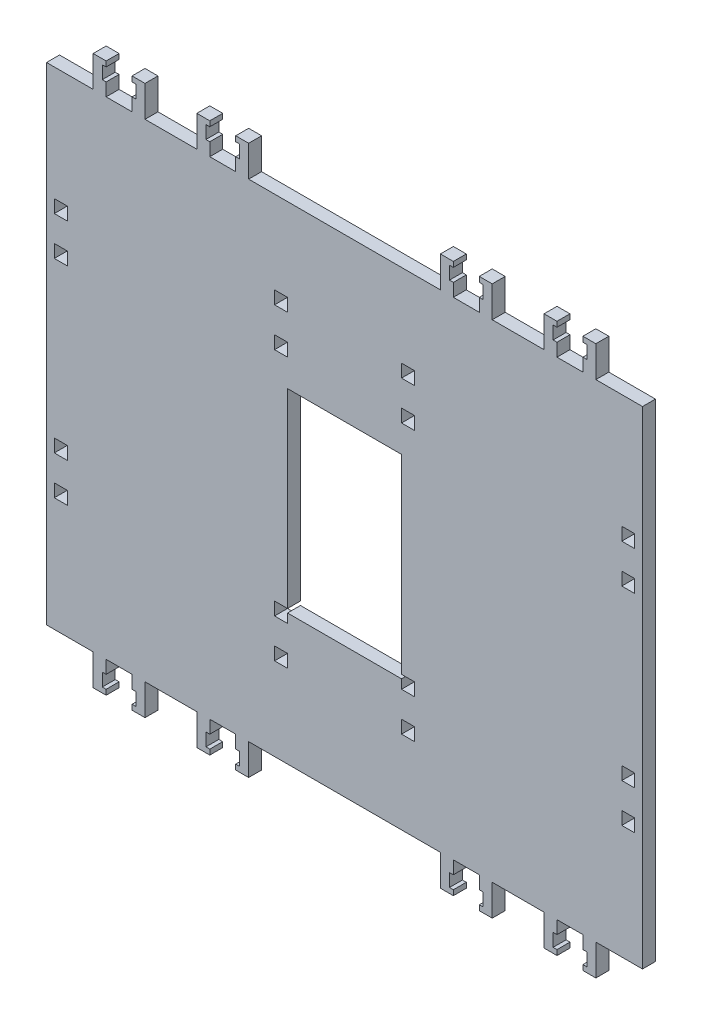
from build123d import *

# Parameters (mm, degrees)
ESQUISSE1_W        = 5
ESQUISSE1_H        = 5
BOSS_EXTRU_1_DEPTH = 5


with BuildPart() as part:
    # Esquisse1 → Boss.-Extru.1 (new body)
    with BuildSketch(Plane.XY):
        Polygon((-30, 193), (-30, 188), (-45, 188), (-89, 188), (-104, 188), (-104, 193), (-104, 200), (-109, 200), (-109, 198), (-107.5, 198), (-107.5, 193), (-109, 193), (-109, 188), (-114, 188), (-119, 188), (-119, 193), (-120.5, 193), (-120.5, 198), (-119, 198), (-119, 200), (-124, 200), (-124, 193), (-124, 188), (-144, 188), (-144, 193), (-144, 200), (-149, 200), (-149, 198), (-147.5, 198), (-147.5, 193), (-149, 193), (-149, 188), (-154, 188), (-159, 188), (-159, 193), (-160.5, 193), (-160.5, 198), (-159, 198), (-159, 200), (-164, 200), (-164, 193), (-164, 188), (-179, 188), (-182, 188), (-182, 0), (-179, 0), (-164, 0), (-164, -5), (-164, -12), (-159, -12), (-159, -10), (-160.5, -10), (-160.5, -5), (-159, -5), (-159, 0), (-154, 0), (-149, 0), (-149, -5), (-147.5, -5), (-147.5, -10), (-149, -10), (-149, -12), (-144, -12), (-144, -5), (-144, 0), (-124, 0), (-124, -5), (-124, -12), (-119, -12), (-119, -10), (-120.5, -10), (-120.5, -5), (-119, -5), (-119, 0), (-114, 0), (-109, 0), (-109, -5), (-107.5, -5), (-107.5, -10), (-109, -10), (-109, -12), (-104, -12), (-104, -5), (-104, 0), (-89, 0), (-45, 0), (-30, 0), (-30, -5), (-30, -12), (-25, -12), (-25, -10), (-26.5, -10), (-26.5, -5), (-25, -5), (-25, 0), (-20, 0), (-15, 0), (-15, -5), (-13.5, -5), (-13.5, -10), (-15, -10), (-15, -12), (-10, -12), (-10, -5), (-10, 0), (10, 0), (10, -5), (10, -12), (15, -12), (15, -10), (13.5, -10), (13.5, -5), (15, -5), (15, 0), (20, 0), (25, 0), (25, -5), (26.5, -5), (26.5, -10), (25, -10), (25, -12), (30, -12), (30, -5), (30, 0), (45, 0), (48, 0), (48, 188), (45, 188), (30, 188), (30, 193), (30, 200), (25, 200), (25, 198), (26.5, 198), (26.5, 193), (25, 193), (25, 188), (20, 188), (15, 188), (15, 193), (13.5, 193), (13.5, 198), (15, 198), (15, 200), (10, 200), (10, 193), (10, 188), (-10, 188), (-10, 193), (-10, 200), (-15, 200), (-15, 198), (-13.5, 198), (-13.5, 193), (-15, 193), (-15, 188), (-20, 188), (-25, 188), (-25, 193), (-26.5, 193), (-26.5, 198), (-25, 198), (-25, 200), (-30, 200), align=None)
        with Locations((-91.5, 34.5)):
            Rectangle(ESQUISSE1_W, ESQUISSE1_H, mode=Mode.SUBTRACT)
        with Locations((-176.5, 46.5)):
            Rectangle(ESQUISSE1_W, ESQUISSE1_H, mode=Mode.SUBTRACT)
        with Locations((-176.5, 61.5)):
            Rectangle(ESQUISSE1_W, ESQUISSE1_H, mode=Mode.SUBTRACT)
        Polygon((-89, 125.5), (-45, 125.5), (-45, 52), (-40, 52), (-40, 47), (-45, 47), (-45, 50.5), (-67, 50.5), (-89, 50.5), (-89, 47), (-94, 47), (-94, 52), (-89, 52), align=None, mode=Mode.SUBTRACT)
        with Locations((-42.5, 34.5)):
            Rectangle(ESQUISSE1_W, ESQUISSE1_H, mode=Mode.SUBTRACT)
        with Locations((42.5, 46.5)):
            Rectangle(ESQUISSE1_W, ESQUISSE1_H, mode=Mode.SUBTRACT)
        with Locations((42.5, 61.5)):
            Rectangle(ESQUISSE1_W, ESQUISSE1_H, mode=Mode.SUBTRACT)
        with Locations((-176.5, 126.5)):
            Rectangle(ESQUISSE1_W, ESQUISSE1_H, mode=Mode.SUBTRACT)
        with Locations((-176.5, 141.5)):
            Rectangle(ESQUISSE1_W, ESQUISSE1_H, mode=Mode.SUBTRACT)
        with Locations((-91.5, 138.5)):
            Rectangle(ESQUISSE1_W, ESQUISSE1_H, mode=Mode.SUBTRACT)
        with Locations((-91.5, 153.5)):
            Rectangle(ESQUISSE1_W, ESQUISSE1_H, mode=Mode.SUBTRACT)
        with Locations((-42.5, 138.5)):
            Rectangle(ESQUISSE1_W, ESQUISSE1_H, mode=Mode.SUBTRACT)
        with Locations((42.5, 126.5)):
            Rectangle(ESQUISSE1_W, ESQUISSE1_H, mode=Mode.SUBTRACT)
        with Locations((42.5, 141.5)):
            Rectangle(ESQUISSE1_W, ESQUISSE1_H, mode=Mode.SUBTRACT)
        with Locations((-42.5, 153.5)):
            Rectangle(ESQUISSE1_W, ESQUISSE1_H, mode=Mode.SUBTRACT)
    extrude(amount=BOSS_EXTRU_1_DEPTH)


solid = part.part
